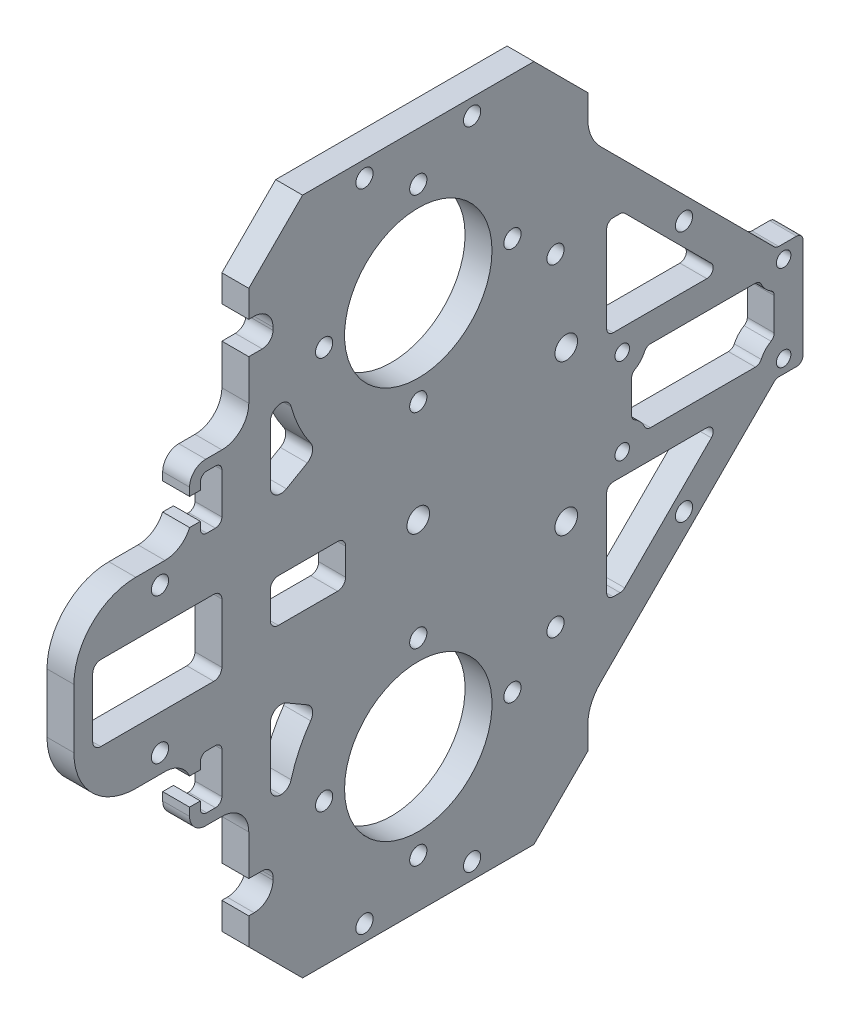
from build123d import *

# Parameters (mm, degrees)
SKETCH_1_R           = 10
EXTRUDE_1_DEPTH      = 5
SKETCH_2_R           = 13.7
SKETCH_2_R_2         = 1.6
CUT_EXTRUDE_1_DEPTH  = 99.076500753
SKETCH_4_R           = 2.1
CUT_EXTRUDE_2_DEPTH  = 99.076500753
SKETCH_5_W           = 32
SKETCH_5_H           = 70
CUT_EXTRUDE_3_DEPTH  = 10
SKETCH_6_W           = 32.5
SKETCH_6_H           = 34
EXTRUDE_2_DEPTH      = 5
SKETCH_8_R           = 1.6
CUT_EXTRUDE_4_DEPTH  = 99.076500753
SKETCH_9_W           = 14
SKETCH_9_H           = 8
SKETCH_9_W_2         = 24
SKETCH_9_H_2         = 14
CUT_EXTRUDE_5_DEPTH  = 99.076500753
FILLET_2_R           = 1.5
FILLET_3_R           = 11.5
SKETCH_11_R          = 1.6
CUT_EXTRUDE_7_DEPTH  = 99.076500753
SKETCH_14_W          = 40
SKETCH_14_H          = 21
EXTRUDE_4_DEPTH      = 5
CUT_EXTRUDE_10_DEPTH = 132.221187314
SKETCH_16_R          = 1.35
CUT_EXTRUDE_9_DEPTH  = 132.221187314
CUT_EXTRUDE_11_DEPTH = 10
FILLET_6_R           = 1.2
SKETCH_15_R          = 1.6
CUT_EXTRUDE_8_DEPTH  = 10
FILLET_7_R           = 1.2
FILLET_8_R           = 1.2
FILLET_9_R           = 8
SKETCH_20_W          = 9
SKETCH_20_H          = 6
CUT_EXTRUDE_13_DEPTH = 132.221187314
FILLET_12_R          = 2
FILLET_13_R          = 3.5
CUT_EXTRUDE_14_DEPTH = 132.221187314
FILLET_14_R          = 2
EXTRUDE_5_DEPTH      = 5
FILLET_15_R          = 1.2
FILLET_16_R          = 5
FILLET_17_R          = 3
MIRROR_3_DEPTH       = 5
FILLET_18_R          = 5


# Read off the part's stored shape, not the designer's step: 镜向3
with BuildPart() as part:
    # 草图1 → 凸台-拉伸1 (new body)
    with BuildSketch(Plane(origin=(0, 0, 0), x_dir=(0, 0, -1), z_dir=(1, 0, 0))):
        with BuildLine():
            Line((12, 53), (12, 35))
            Line((12, 35), (-11.900954023, 12.830327094))
            ThreePointArc((-11.900954023, 12.830327094), (-17.5, 0), (-11.900954023, -12.830327094))
            Line((-11.900954023, -12.830327094), (12, -35))
            Line((12, -35), (12, -53))
            Line((12, -53), (22, -63))
            Line((22, -63), (65, -63))
            Line((65, -63), (75, -53))
            Line((75, -53), (75, 53))
            Line((75, 53), (65, 63))
            Line((65, 63), (22, 63))
            Line((22, 63), (12, 53))
        make_face()
        Circle(SKETCH_1_R, mode=Mode.SUBTRACT)
    extrude(amount=EXTRUDE_1_DEPTH)

    # 草图2 → 切除-拉伸1 (cut, through all)
    with BuildSketch(Plane(origin=(5, 0, 0), x_dir=(0, 0, -1), z_dir=(1, 0, 0))):
        with Locations((43.5, 36.5)):
            Circle(SKETCH_2_R)
        with Locations((43.5, 54)):
            Circle(SKETCH_2_R_2)
        with Locations((61, 36.5)):
            Circle(SKETCH_2_R_2)
        with Locations((43.5, 19)):
            Circle(SKETCH_2_R_2)
        with Locations((26, 36.5)):
            Circle(SKETCH_2_R_2)
        with Locations(Location((26, -36.5, 0), (0, 0, 180))):
            Circle(SKETCH_2_R_2)
        with Locations(Location((43.5, -19, 0), (0, 0, 180))):
            Circle(SKETCH_2_R_2)
        with Locations(Location((61, -36.5, 0), (0, 0, 180))):
            Circle(SKETCH_2_R_2)
        with Locations(Location((43.5, -54, 0), (0, 0, 180))):
            Circle(SKETCH_2_R_2)
        with Locations(Location((43.5, -36.5, 0), (0, 0, 180))):
            Circle(SKETCH_2_R)
    extrude(amount=-CUT_EXTRUDE_1_DEPTH, mode=Mode.SUBTRACT)

    # 草图4 → 切除-拉伸2 (cut, through all)
    with BuildSketch(Plane(origin=(5, 0, 0), x_dir=(0, 0, -1), z_dir=(1, 0, 0))):
        with Locations((71, 14)):
            Circle(SKETCH_4_R)
        with Locations(Location((71, -14, 0), (0, 0, 180))):
            Circle(SKETCH_4_R)
        with Locations((43.5, 0)):
            Circle(SKETCH_4_R)
    extrude(amount=-CUT_EXTRUDE_2_DEPTH, mode=Mode.SUBTRACT)

    # 草图5 → 切除-拉伸3 (cut)
    with BuildSketch(Plane(origin=(5, 0, 0), x_dir=(0, 0, -1), z_dir=(1, 0, 0))):
        with Locations((-4, 0)):
            Rectangle(SKETCH_5_W, SKETCH_5_H)
    extrude(amount=-CUT_EXTRUDE_3_DEPTH, mode=Mode.SUBTRACT)

    # 草图6 → 凸台-拉伸2 (add)
    with BuildSketch(Plane(origin=(5, 0, 0), x_dir=(0, 0, -1), z_dir=(1, 0, 0))):
        with Locations((-4.25, 0)):
            Rectangle(SKETCH_6_W, SKETCH_6_H)
    extrude(amount=-EXTRUDE_2_DEPTH)

    # 草图8 → 切除-拉伸4 (cut, through all)
    with BuildSketch(Plane(origin=(5, 0, 0), x_dir=(0, 0, -1), z_dir=(1, 0, 0))):
        with Locations((-4.5, 13.5)):
            Circle(SKETCH_8_R)
        with Locations(Location((-4.5, -13.5, 0), (0, 0, 180))):
            Circle(SKETCH_8_R)
    extrude(amount=-CUT_EXTRUDE_4_DEPTH, mode=Mode.SUBTRACT)

    # 草图9 → 切除-拉伸5 (cut, through all)
    with BuildSketch(Plane.ZY):
        with Locations((-23, 0)):
            Rectangle(SKETCH_9_W, SKETCH_9_H)
        with Locations((5, 0)):
            Rectangle(SKETCH_9_W_2, SKETCH_9_H_2)
    extrude(amount=-CUT_EXTRUDE_5_DEPTH, mode=Mode.SUBTRACT)

    # 圆角2
    fillet_2_edges = [part.edges().sort_by_distance(p)[0] for p in [
        (2.5, -4, -30),
        (2.5, 4, -30),
        (2.5, 4, -16),
        (2.5, -4, -16),
        (2.5, -7, -7),
        (2.5, 7, -7),
        (2.5, 7, 17),
        (2.5, -7, 17),
    ]]
    fillet(fillet_2_edges, radius=FILLET_2_R)

    # 圆角3
    fillet_3_edges = [part.edges().sort_by_distance(p)[0] for p in [
        (2.5, -17, 20.5),
        (2.5, 17, 20.5),
    ]]
    fillet(fillet_3_edges, radius=FILLET_3_R)

    # 草图11 → 切除-拉伸7 (cut, through all)
    with BuildSketch(Plane.ZY):
        with Locations((-33.5, 60)):
            Circle(SKETCH_11_R)
        with Locations((-53.5, 60)):
            Circle(SKETCH_11_R)
        with Locations(Location((-53.5, -60, 0), (0, 0, 180))):
            Circle(SKETCH_11_R)
        with Locations(Location((-33.5, -60, 0), (0, 0, 180))):
            Circle(SKETCH_11_R)
    extrude(amount=-CUT_EXTRUDE_7_DEPTH, mode=Mode.SUBTRACT)

    # 草图14 → 凸台-拉伸4 (add)
    with BuildSketch(Plane(origin=(0, 0, 0), x_dir=(0, 0, -1), z_dir=(1, 0, 0))):
        with Locations((95, 0)):
            Rectangle(SKETCH_14_W, SKETCH_14_H)
        Polygon((75, 10.5), (110, 10.5), (75, 45.5), align=None)
        Polygon((75, -45.5), (110, -10.5), (75, -10.5), align=None)
    extrude(amount=EXTRUDE_4_DEPTH)

    # 草图17 → 切除-拉伸10 (cut, through all)
    with BuildSketch(Plane.ZY):
        Polygon((-81.514718626, 30.5), (-100.014718626, 12), (-78.514718626, 12), (-78.514718626, 30.5), align=None)
        Polygon((-81.514718626, -30.5), (-100.014718626, -12), (-78.514718626, -12), (-78.514718626, -30.5), align=None)
    extrude(amount=-CUT_EXTRUDE_10_DEPTH, mode=Mode.SUBTRACT)

    # 草图16 → 切除-拉伸9 (cut, through all)
    with BuildSketch(Plane.ZY):
        with Locations((-81.4, 8)):
            Circle(SKETCH_16_R)
        with Locations((-81.4, -8)):
            Circle(SKETCH_16_R)
        with Locations((-111.4, 8)):
            Circle(SKETCH_16_R)
        with Locations((-111.4, -8)):
            Circle(SKETCH_16_R)
    extrude(amount=-CUT_EXTRUDE_9_DEPTH, mode=Mode.SUBTRACT)

    # 草图18 → 切除-拉伸11 (cut)
    with BuildSketch(Plane.ZY):
        with BuildLine():
            ThreePointArc((-109.65, -3.745884346), (-107.965655697, -4.939725631), (-106.973093631, -6.75))
            Line((-106.973093631, -6.75), (-85.826906369, -6.75))
            ThreePointArc((-85.826906369, -6.75), (-84.834344303, -4.939725631), (-83.15, -3.745884346))
            Line((-83.15, -3.745884346), (-83.15, 3.745884346))
            ThreePointArc((-83.15, 3.745884346), (-84.834344303, 4.939725631), (-85.826906369, 6.75))
            Line((-85.826906369, 6.75), (-106.973093631, 6.75))
            ThreePointArc((-106.973093631, 6.75), (-107.965655697, 4.939725631), (-109.65, 3.745884346))
            Line((-109.65, 3.745884346), (-109.65, -3.745884346))
        make_face()
    extrude(amount=-CUT_EXTRUDE_11_DEPTH, mode=Mode.SUBTRACT)

    # 圆角6
    fillet_6_edges = [part.edges().sort_by_distance(p)[0] for p in [
        (2.5, -6.75, -106.973093631),
        (2.5, -3.745884346, -109.65),
        (2.5, 3.745884346, -109.65),
        (2.5, 6.75, -106.973093631),
        (2.5, 6.75, -85.826906369),
        (2.5, 3.745884346, -83.15),
        (2.5, -3.745884346, -83.15),
        (2.5, -6.75, -85.826906369),
    ]]
    fillet(fillet_6_edges, radius=FILLET_6_R)

    # 草图15 → 切除-拉伸8 (cut)
    with BuildSketch(Plane.ZY):
        with Locations((-92.886038969, 23.371320344)):
            Circle(SKETCH_15_R)
        with Locations((-69, 30)):
            Circle(SKETCH_15_R)
        with Locations(Location((-69, -30, 0), (0, 0, 180))):
            Circle(SKETCH_15_R)
        with Locations(Location((-92.886038969, -23.371320344, 0), (0, 0, 180))):
            Circle(SKETCH_15_R)
    extrude(amount=-CUT_EXTRUDE_8_DEPTH, mode=Mode.SUBTRACT)

    # 圆角7
    fillet_7_edges = [part.edges().sort_by_distance(p)[0] for p in [
        (2.5, 30.5, -81.514718626),
        (2.5, 30.5, -78.514718626),
        (2.5, 12, -78.514718626),
        (2.5, 12, -100.014718626),
        (2.5, -30.5, -78.514718626),
        (2.5, -30.5, -81.514718626),
        (2.5, -12, -100.014718626),
        (2.5, -12, -78.514718626),
    ]]
    fillet(fillet_7_edges, radius=FILLET_7_R)

    # 圆角8
    fillet_8_edges = [part.edges().sort_by_distance(p)[0] for p in [
        (2.5, -10.5, -110),
        (2.5, 10.5, -115),
        (2.5, -10.5, -115),
        (2.5, 10.5, -110),
    ]]
    fillet(fillet_8_edges, radius=FILLET_8_R)

    # 圆角9
    fillet_9_edges = [part.edges().sort_by_distance(p)[0] for p in [
        (2.5, -45.5, -75),
        (2.5, 45.5, -75),
    ]]
    fillet(fillet_9_edges, radius=FILLET_9_R)

    # 草图20 → 切除-拉伸13 (cut, through all)
    with BuildSketch(Plane(origin=(5, 0, 0), x_dir=(0, 0, -1), z_dir=(1, 0, 0))):
        with Locations((12, -45)):
            Rectangle(SKETCH_20_W, SKETCH_20_H)
        with Locations((12, 45)):
            Rectangle(SKETCH_20_W, SKETCH_20_H)
    extrude(amount=-CUT_EXTRUDE_13_DEPTH, mode=Mode.SUBTRACT)

    # 圆角12
    fillet_12_edges = [part.edges().sort_by_distance(p)[0] for p in [
        (2.5, -42, -16.5),
        (2.5, 42, -16.5),
    ]]
    fillet(fillet_12_edges, radius=FILLET_12_R)

    # 圆角13
    fillet_13_edges = [part.edges().sort_by_distance(p)[0] for p in [
        (2.5, -48, -16.5),
        (2.5, 48, -16.5),
    ]]
    fillet(fillet_13_edges, radius=FILLET_13_R)

    # 草图22 → 切除-拉伸14 (cut, through all)
    with BuildSketch(Plane.ZY):
        with BuildLine():
            Line((-19.51563009, 31.5), (-16, 31.5))
            Line((-16, 31.5), (-16, 15.5))
            Line((-16, 15.5), (-24.85141796, 20.610368542))
            ThreePointArc((-24.85141796, 20.610368542), (-21.4991326, 25.71984074), (-19.51563009, 31.5))
        make_face()
        with BuildLine():
            Line((-16, -15.5), (-24.85141796, -20.610368542))
            ThreePointArc((-24.85141796, -20.610368542), (-21.4991326, -25.71984074), (-19.51563009, -31.5))
            Line((-19.51563009, -31.5), (-16, -31.5))
            Line((-16, -31.5), (-16, -15.5))
        make_face()
    extrude(amount=-CUT_EXTRUDE_14_DEPTH, mode=Mode.SUBTRACT)

    # 圆角14
    # the kernel refuses this fillet: 2 mm, written as the material it adds along each edge
    with BuildSketch(Plane(origin=(0, -31.5, -19.51563009), x_dir=(0, 0, 1), z_dir=(1, 0, 0))) as fillet_14_piece_1:
        with BuildLine():
            CenterArc((1.574385928, -2), FILLET_14_R, 90, 74.683492171)
            ThreePointArc((-0.354576777, -1.471698113), (-0.165918986, -0.738588291), (0, 0))
            Line((0, 0), (1.574385928, 0))
        make_face()
    extrude(amount=5)
    with BuildSketch(Plane(origin=(0, -31.5, -16), x_dir=(0, 1, 0), z_dir=(1, 0, 0)), Plane(origin=(0, 31.5, -16), x_dir=(0, 0, -1), z_dir=(1, 0, 0))) as fillet_14_piece_2:
        with BuildLine():
            CenterArc((FILLET_14_R, -FILLET_14_R), FILLET_14_R, 90, 90)
            Line((0, -FILLET_14_R), (0, 0))
            Line((0, 0), (FILLET_14_R, 0))
        make_face()
    extrude(amount=5)
    with BuildSketch(Plane(origin=(0, -15.5, -16), x_dir=(0, -1, 0), z_dir=(1, 0, 0))) as fillet_14_piece_3:
        with BuildLine():
            CenterArc((FILLET_14_R * 1.73205080757, FILLET_14_R), FILLET_14_R, 150, 120)
            Line((FILLET_14_R * 0.866025403784, FILLET_14_R * 1.5), (0, 0))
            Line((0, 0), (FILLET_14_R * 1.73205080757, 0))
        make_face()
    extrude(amount=5)
    with BuildSketch(Plane(origin=(0, -20.610368542, -24.85141796), x_dir=(0, -0.7895751914888833, 0.6136538250392424), z_dir=(1, 0, 0))) as fillet_14_piece_4:
        with BuildLine():
            CenterArc((2.294552659, -1.997974764), FILLET_14_R, 92.578677978, 95.275491836)
            Line((0.313314486, -2.271279176), (0, 0))
            ThreePointArc((0, 0), (1.102285101, -0.024809142), (2.204570201, 0))
        make_face()
    extrude(amount=5)
    with BuildSketch(Plane(origin=(0, 31.5, -19.51563009), x_dir=(0, -0.9721816703743521, -0.2342280935074494), z_dir=(1, 0, 0))) as fillet_14_piece_5:
        with BuildLine():
            CenterArc((1.575597926, -1.999045328), FILLET_14_R, 91.770381921, 74.683492171)
            Line((-0.368765414, -1.530589141), (0, 0))
            ThreePointArc((0, 0), (0.756904886, -0.01169473), (1.513809772, 0))
        make_face()
    extrude(amount=5)
    with BuildSketch(Plane(origin=(0, 20.610368542, -24.85141796), x_dir=(0, 0.7895751914888824, 0.6136538250392436), z_dir=(1, 0, 0))) as fillet_14_piece_6:
        with BuildLine():
            CenterArc((2.294552659, 1.997974764), FILLET_14_R, 172.145830186, 95.275491836)
            Line((0.313314486, 2.271279176), (0, 0))
            ThreePointArc((0, 0), (1.102285101, 0.024809142), (2.204570201, 0))
        make_face()
    extrude(amount=5)
    with BuildSketch(Plane(origin=(0, 15.5, -16), x_dir=(0, 1, 0), z_dir=(1, 0, 0))) as fillet_14_piece_7:
        with BuildLine():
            CenterArc((FILLET_14_R * 1.73205080757, -FILLET_14_R), FILLET_14_R, 90, 120)
            Line((FILLET_14_R * 0.866025403784, -FILLET_14_R * 1.5), (0, 0))
            Line((0, 0), (FILLET_14_R * 1.73205080757, 0))
        make_face()
    extrude(amount=5)

    # 草图24 → 凸台-拉伸5 (add)
    with BuildSketch(Plane(origin=(0, 0, 0), x_dir=(0, 0, -1), z_dir=(1, 0, 0))):
        Polygon((12, -17), (1, -17), (1, -20), (3, -20), (3, -17.5), (7, -17.5), (7, -27.5), (3, -27.5), (3, -25), (1, -25), (1, -29.5), (12, -29.5), align=None)
    extrude(amount=EXTRUDE_5_DEPTH)

    # 圆角15
    fillet_15_edges = [part.edges().sort_by_distance(p)[0] for p in [
        (2.5, -17.5, -3),
        (2.5, -17.5, -7),
        (2.5, -27.5, -7),
        (2.5, -27.5, -3),
    ]]
    fillet(fillet_15_edges, radius=FILLET_15_R)

    # 圆角16
    # the kernel refuses this fillet: 5 mm, written as the material it adds along each edge
    with BuildSketch(Plane(origin=(0, -29.5, -12), x_dir=(0, 0, 1), z_dir=(1, 0, 0))) as fillet_16_piece_1:
        with BuildLine():
            CenterArc((FILLET_16_R, FILLET_16_R), FILLET_16_R, 180, 90)
            Line((0, FILLET_16_R), (-FILLET_16_R * 0.02, FILLET_16_R))
            Line((-FILLET_16_R * 0.02, FILLET_16_R), (-FILLET_16_R * 0.02, -FILLET_16_R * 0.02))
            Line((-FILLET_16_R * 0.02, -FILLET_16_R * 0.02), (FILLET_16_R, -FILLET_16_R * 0.02))
            Line((FILLET_16_R, -FILLET_16_R * 0.02), (FILLET_16_R, 0))
        make_face()
    extrude(amount=5)
    with BuildSketch(Plane(origin=(0, -17, -1), x_dir=(0, -1, 0), z_dir=(1, 0, 0))) as fillet_16_piece_2:
        with BuildLine():
            CenterArc((5, -4.582575695), FILLET_16_R, 113.578178478, 66.421821522)
            Line((0, -4.582575695), (-0.1, -4.582575695))
            Line((-0.1, -4.582575695), (-0.1, 0))
            Line((-0.1, 0), (0, 0.1))
            ThreePointArc((0, 0.1), (1.5, 0.1), (2.96, 0.091651514))
            Line((2.96, 0.091651514), (3, 0))
        make_face()
    extrude(amount=5)

    # 圆角17
    fillet_17_edges = [part.edges().sort_by_distance(p)[0] for p in [
        (2.5, -29.5, -1),
    ]]
    fillet(fillet_17_edges, radius=FILLET_17_R)

    # 镜向3 outline → 镜向3 (add)
    with BuildSketch(Plane.YZ):
        with BuildLine():
            ThreePointArc((27.5, -5.8), (27.148528137, -6.648528137), (26.3, -7))
            Line((26.3, -7), (18.7, -7))
            ThreePointArc((18.7, -7), (17.851471863, -6.648528137), (17.5, -5.8))
            Line((17.5, -5.8), (17.5, -4.2))
            ThreePointArc((17.5, -4.2), (17.851471863, -3.351471863), (18.7, -3))
            Line((18.7, -3), (20, -3))
            Line((20, -3), (20, -1))
            Line((20, -1), (17, -1))
            Line((17, -1), (17, -12))
            Line((17, -12), (34.5, -12))
            ThreePointArc((34.5, -12), (30.964466094, -10.535533906), (29.5, -7))
            Line((29.5, -7), (29.5, -4))
            ThreePointArc((29.5, -4), (28.621320344, -1.878679656), (26.5, -1))
            Line((26.5, -1), (25, -1))
            Line((25, -1), (25, -3))
            Line((25, -3), (26.3, -3))
            ThreePointArc((26.3, -3), (27.148528137, -3.351471863), (27.5, -4.2))
            Line((27.5, -4.2), (27.5, -5.8))
        make_face()
    extrude(amount=MIRROR_3_DEPTH)

    # 圆角18
    # the kernel refuses this fillet: 5 mm, written as the material it adds along each edge
    with BuildSketch(Plane(origin=(0, 17, -1), x_dir=(0, 0, 1), z_dir=(1, 0, 0))) as fillet_18_piece_1:
        with BuildLine():
            CenterArc((4.582575695, -5), FILLET_18_R, 90, 66.421821522)
            Line((0, -3), (-0.091651514, -2.96))
            ThreePointArc((-0.091651514, -2.96), (-0.1, -1.5), (-0.1, 0))
            Line((-0.1, 0), (0, 0.1))
            Line((0, 0.1), (4.582575695, 0.1))
            Line((4.582575695, 0.1), (4.582575695, 0))
        make_face()
    extrude(amount=5)


solid = part.part
